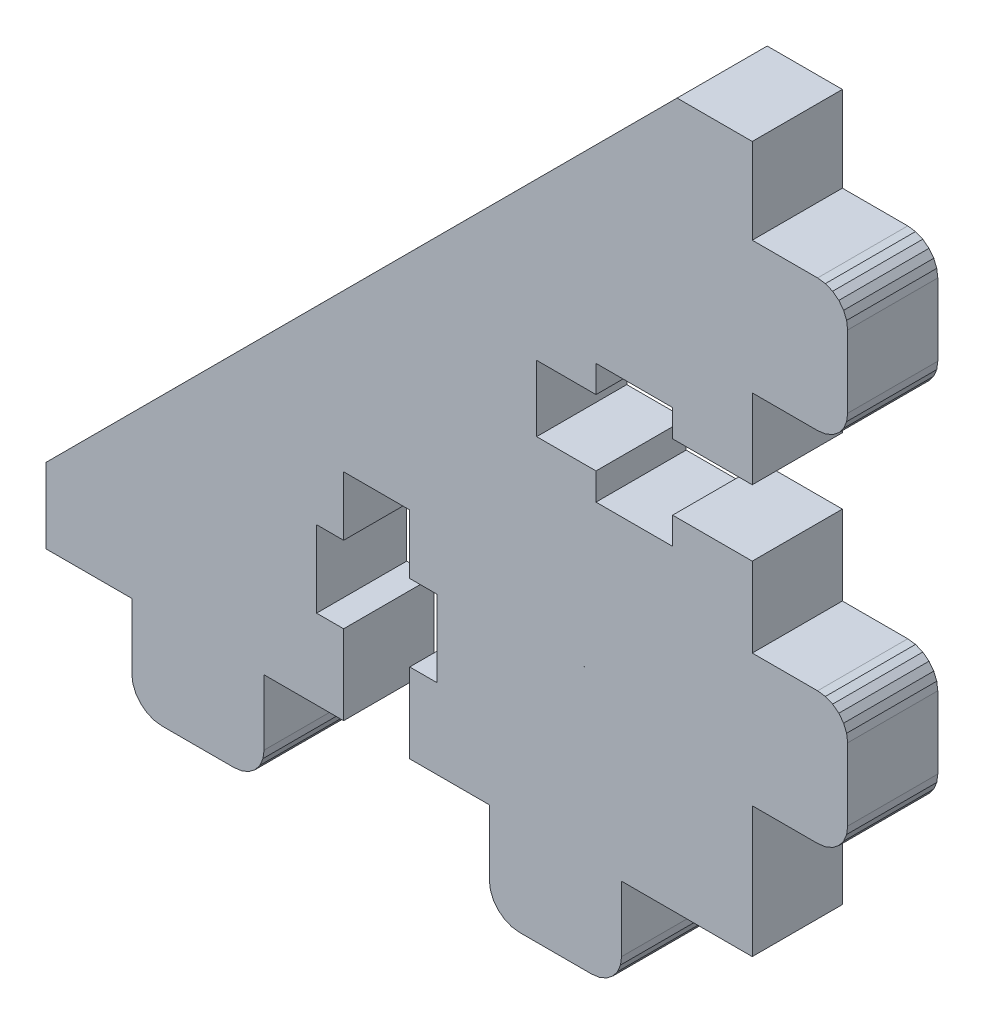
from build123d import *

# Parameters (mm, degrees)
SKETCH1_W           = 2.235327744
SKETCH1_H           = 0.000381097
BOSS_EXTRUDE1_DEPTH = 6


with BuildPart() as part:
    # Sketch1 → Boss-Extrude1 (new body)
    with BuildSketch(Plane.XY):
        Polygon((412.902108791, 119.111993946), (412.902108791, 120.911992178), (418.002106555, 120.911992178), (418.002106555, 119.111993946), (423.302105377, 119.111993946), (423.302105377, 124.411991201), (427.652103268, 124.411991201), (428.169741359, 124.480139548), (428.652103268, 124.679940393), (429.066316831, 124.997777638), (429.384154076, 125.411991201), (429.583954921, 125.89435311), (429.652103268, 126.411991201), (429.652103268, 131.211985643), (429.583954921, 131.729623733), (429.384154076, 132.211985643), (429.066316831, 132.626199205), (428.652103268, 132.94403645), (428.169741359, 133.143837295), (427.652103268, 133.211985643), (423.302105377, 133.211985643), (423.302105377, 138.904950598), (418.298108804, 138.904950598), (376.305001508, 96.913274507), (376.305001508, 91.911999237), (382.002122993, 91.911999237), (382.002122993, 87.562001346), (382.07027134, 87.044363256), (382.270072185, 86.562001346), (382.58790943, 86.147787784), (383.002122993, 85.829950538), (383.484484903, 85.630149693), (384.002122993, 85.562001346), (388.802118958, 85.562001346), (389.319757048, 85.630149693), (389.802118958, 85.829950538), (390.21633252, 86.147787784), (390.534169765, 86.562001346), (390.73397061, 87.044363256), (390.802118958, 87.562001346), (390.802118958, 91.911999237), (396.102110965, 91.911999237), (396.102110965, 97.211998059), (394.302112733, 97.211998059), (394.302112733, 102.311995824), (396.102110965, 102.311995824), (396.102110965, 106.261995646), (400.502115636, 106.261995646), (400.502115636, 102.311995824), (402.302113868, 102.311995824), (402.302113868, 97.211998059), (400.502115636, 97.211998059), (400.502115636, 91.911999237), (405.802112891, 91.911999237), (405.802112891, 87.562001346), (405.870261239, 87.044363256), (406.070062084, 86.562001346), (406.387899329, 86.147787784), (406.802112891, 85.829950538), (407.284474801, 85.630149693), (407.802112891, 85.562001346), (412.602107333, 85.562001346), (413.119745424, 85.630149693), (413.602107333, 85.829950538), (414.016320896, 86.147787784), (414.334158141, 86.562001346), (414.533958986, 87.044363256), (414.602107333, 87.562001346), (414.602107333, 91.911999237), (423.302105377, 91.911999237), (423.302105377, 100.612001302), (427.652103268, 100.612001302), (428.169741359, 100.680149649), (428.652103268, 100.879950494), (429.066316831, 101.19778774), (429.384154076, 101.612001302), (429.583954921, 102.094363212), (429.652103268, 102.612001302), (429.652103268, 107.411997267), (429.583954921, 107.929635357), (429.384154076, 108.411997267), (429.066316831, 108.826210829), (428.652103268, 109.144048075), (428.169741359, 109.34384892), (427.652103268, 109.411997267), (423.302105377, 109.411997267), (423.302105377, 114.711989274), (418.002106555, 114.711989274), (418.002106555, 112.911991042), (412.902108791, 112.911991042), (412.902108791, 114.711989274), (408.952108969, 114.711989274), (408.952108969, 119.111993946), align=None)
        with Locations((412.888404907, 103.030973429)):
            Rectangle(SKETCH1_W, SKETCH1_H, mode=Mode.SUBTRACT)
    extrude(amount=BOSS_EXTRUDE1_DEPTH)


solid = part.part
